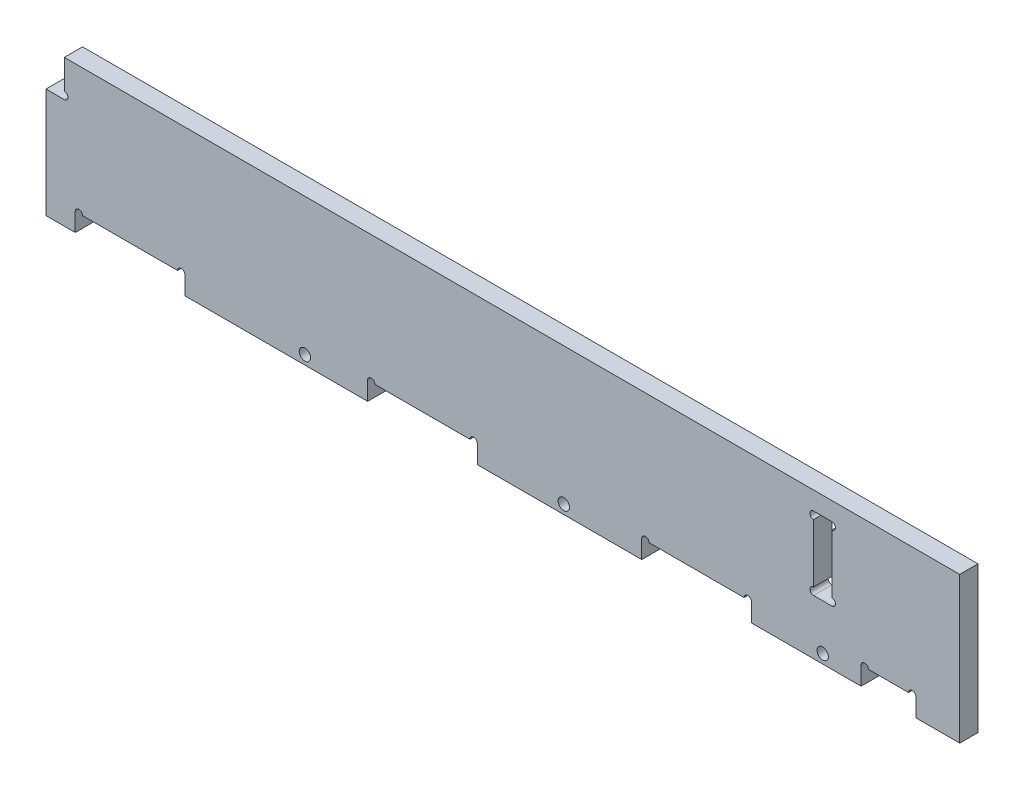
from build123d import *

# Parameters (mm, degrees)
SKETCH_1_W          = 250
SKETCH_1_H          = 40
EXTRUDE_1_DEPTH     = 5
SKETCH_2_W          = 5
SKETCH_2_H          = 10
SKETCH_2_W_2        = 30
SKETCH_2_H_2        = 5
SKETCH_2_W_3        = 15
SKETCH_2_H_3        = 20
CUT_EXTRUDE_1_DEPTH = 5
SKETCH_3_R          = 1
CUT_EXTRUDE_2_DEPTH = 5
SKETCH_4_R          = 1.55
CUT_EXTRUDE_3_DEPTH = 10


with BuildPart() as part:
    # 스케치1 → 보스-돌출1 (new body)
    with BuildSketch(Plane.XY):
        with Locations((125, 20)):
            Rectangle(SKETCH_1_W, SKETCH_1_H)
    extrude(amount=EXTRUDE_1_DEPTH)

    # 스케치2 → 컷-돌출1 (cut)
    with BuildSketch(Plane.XY.offset(5)):
        with Locations((2.5, 35)):
            Rectangle(SKETCH_2_W, SKETCH_2_H)
        with Locations((23, 2.5)):
            Rectangle(SKETCH_2_W_2, SKETCH_2_H_2)
        with Locations((103, 2.5)):
            Rectangle(SKETCH_2_W_2, SKETCH_2_H_2)
        with Locations((178, 2.5)):
            Rectangle(SKETCH_2_W_2, SKETCH_2_H_2)
        with Locations((230.5, 2.5)):
            Rectangle(SKETCH_2_W_3, SKETCH_2_H_2)
        with Locations((212.5, 25)):
            Rectangle(SKETCH_2_W, SKETCH_2_H_3)
    extrude(amount=-CUT_EXTRUDE_1_DEPTH, mode=Mode.SUBTRACT)

    # 스케치3 → 컷-돌출2 (cut)
    with BuildSketch(Plane.XY.offset(5)):
        with Locations((237, 5)):
            Circle(SKETCH_3_R)
        with Locations((224, 5)):
            Circle(SKETCH_3_R)
        with Locations((210, 16)):
            Circle(SKETCH_3_R)
        with Locations((215, 16)):
            Circle(SKETCH_3_R)
        with Locations((215, 34)):
            Circle(SKETCH_3_R)
        with Locations((210, 34)):
            Circle(SKETCH_3_R)
        with Locations((164, 5)):
            Circle(SKETCH_3_R)
        with Locations((192, 5)):
            Circle(SKETCH_3_R)
        with Locations((37, 5)):
            Circle(SKETCH_3_R)
        with Locations((89, 5)):
            Circle(SKETCH_3_R)
        with Locations((117, 5)):
            Circle(SKETCH_3_R)
        with Locations((5, 31)):
            Circle(SKETCH_3_R)
        with Locations((9, 5)):
            Circle(SKETCH_3_R)
    extrude(amount=-CUT_EXTRUDE_2_DEPTH, mode=Mode.SUBTRACT)

    # 스케치4 → 컷-돌출3 (cut)
    with BuildSketch(Plane(origin=(0, 0, 0), x_dir=(-1, 0, 0), z_dir=(0, 0, -1))):
        with Locations((-212.5, 2.5)):
            Circle(SKETCH_4_R)
        with Locations((-141.666666667, 2.5)):
            Circle(SKETCH_4_R)
        with Locations((-70.833333333, 2.5)):
            Circle(SKETCH_4_R)
    extrude(amount=-CUT_EXTRUDE_3_DEPTH, mode=Mode.SUBTRACT)


solid = part.part
